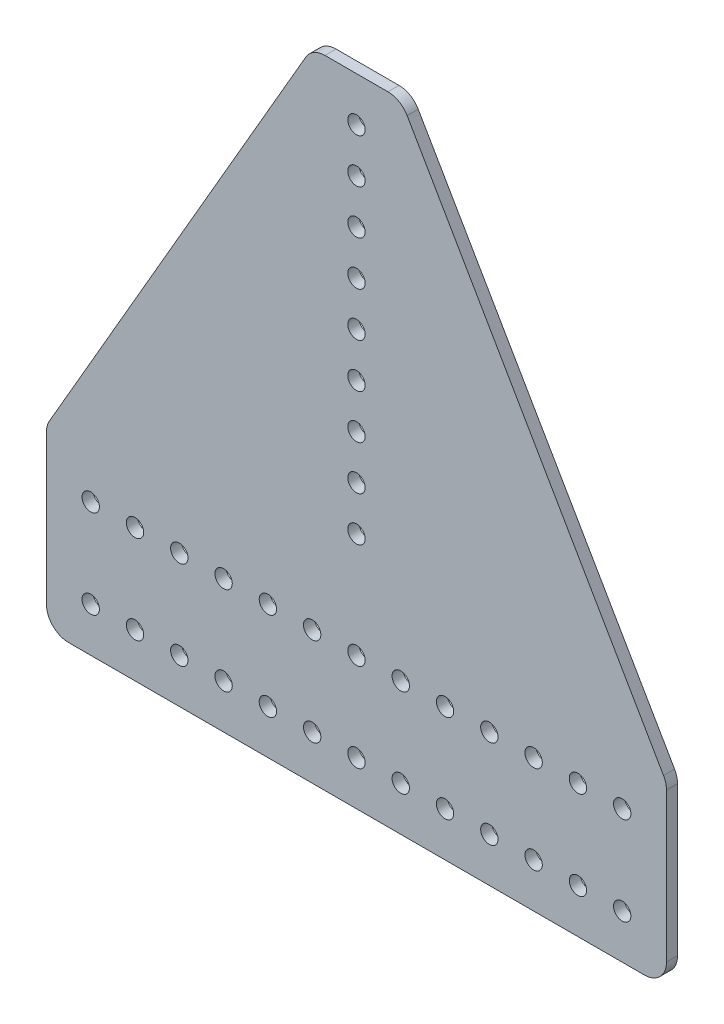
from build123d import *

# Parameters (mm, degrees)
BOSS_EXTRUDE1_DEPTH = 3.175
SKETCH2_R           = 2.4892
CUT_EXTRUDE1_DEPTH  = 255.856797106
FILLET1_R           = 6.35


with BuildPart() as part:
    # Sketch1 → Boss-Extrude1 (new body)
    with BuildSketch(Plane.XY):
        Polygon((0, 0), (0, 50.8), (76.2, 182.5625), (101.6, 182.5625), (177.8, 50.8), (177.8, 0), align=None)
    extrude(amount=-BOSS_EXTRUDE1_DEPTH)

    # Sketch2 → Cut-Extrude1 (cut, through all)
    with BuildSketch(Plane.XY):
        with Locations((12.7, 12.7)):
            Circle(SKETCH2_R)
        with Locations((25.4, 12.7)):
            Circle(SKETCH2_R)
        with Locations((38.1, 12.7)):
            Circle(SKETCH2_R)
        with Locations((50.8, 12.7)):
            Circle(SKETCH2_R)
        with Locations((63.5, 12.7)):
            Circle(SKETCH2_R)
        with Locations((76.2, 12.7)):
            Circle(SKETCH2_R)
        with Locations((88.9, 12.7)):
            Circle(SKETCH2_R)
        with Locations((101.6, 12.7)):
            Circle(SKETCH2_R)
        with Locations((114.3, 12.7)):
            Circle(SKETCH2_R)
        with Locations((127, 12.7)):
            Circle(SKETCH2_R)
        with Locations((139.7, 12.7)):
            Circle(SKETCH2_R)
        with Locations((152.4, 12.7)):
            Circle(SKETCH2_R)
        with Locations((165.1, 12.7)):
            Circle(SKETCH2_R)
        with Locations((25.4, 38.1)):
            Circle(SKETCH2_R)
        with Locations((38.1, 38.1)):
            Circle(SKETCH2_R)
        with Locations((50.8, 38.1)):
            Circle(SKETCH2_R)
        with Locations((63.5, 38.1)):
            Circle(SKETCH2_R)
        with Locations((76.2, 38.1)):
            Circle(SKETCH2_R)
        with Locations((88.9, 38.1)):
            Circle(SKETCH2_R)
        with Locations((101.6, 38.1)):
            Circle(SKETCH2_R)
        with Locations((114.3, 38.1)):
            Circle(SKETCH2_R)
        with Locations((127, 38.1)):
            Circle(SKETCH2_R)
        with Locations((139.7, 38.1)):
            Circle(SKETCH2_R)
        with Locations((152.4, 38.1)):
            Circle(SKETCH2_R)
        with Locations((165.1, 38.1)):
            Circle(SKETCH2_R)
        with Locations((12.7, 38.1)):
            Circle(SKETCH2_R)
        with Locations((88.9, 169.8625)):
            Circle(SKETCH2_R)
        with Locations((88.9, 157.1625)):
            Circle(SKETCH2_R)
        with Locations((88.9, 144.4625)):
            Circle(SKETCH2_R)
        with Locations((88.9, 131.7625)):
            Circle(SKETCH2_R)
        with Locations((88.9, 119.0625)):
            Circle(SKETCH2_R)
        with Locations((88.9, 106.3625)):
            Circle(SKETCH2_R)
        with Locations((88.9, 93.6625)):
            Circle(SKETCH2_R)
        with Locations((88.9, 80.9625)):
            Circle(SKETCH2_R)
        with Locations((88.9, 68.2625)):
            Circle(SKETCH2_R)
    extrude(amount=-CUT_EXTRUDE1_DEPTH, mode=Mode.SUBTRACT)

    # Fillet1
    fillet1_edges = [part.edges().sort_by_distance(p)[0] for p in [
        (0, 0, -1.5875),
        (177.8, 0, -1.5875),
        (177.8, 50.8, -1.5875),
        (101.6, 182.5625, -1.5875),
        (0, 50.8, -1.5875),
        (76.2, 182.5625, -1.5875),
    ]]
    fillet(fillet1_edges, radius=FILLET1_R)


solid = part.part
